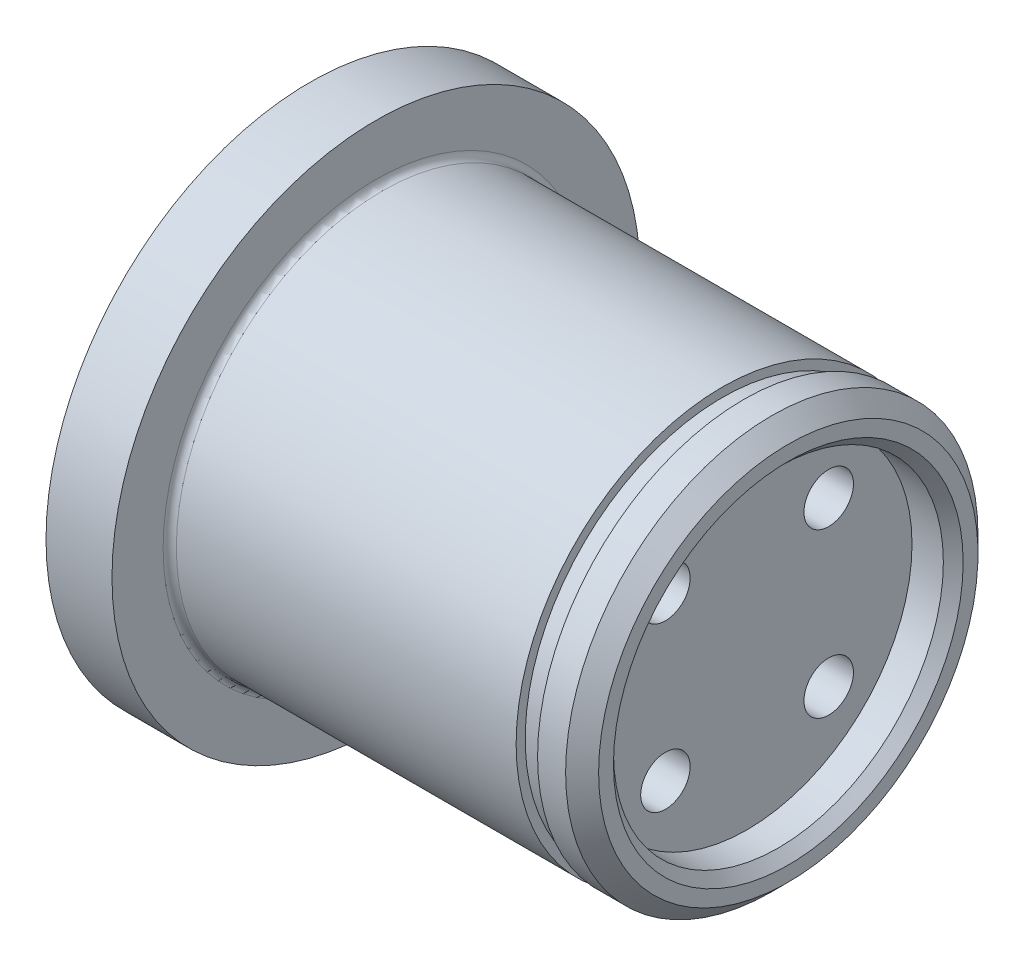
from build123d import *

# Parameters (mm, degrees)
SKETCH_2_W               = 1.3
SKETCH_2_H               = 0.55
CHAMFER_1_SIZE           = 1
FILLET_1_R               = 0.4
HOLE_WIZARD_1_D          = 3
PATTERN_CIRCULAR_1_COUNT = 4
SKETCH_5_W               = 2.5
SKETCH_5_H               = 10
CHAMFER_2_SIZE           = 0.6


with BuildPart() as part:
    # Эскиз1 → Повернуть1 (revolve)
    with BuildSketch(Plane.XY):
        Polygon((0, 0), (0, 12.5), (-25, 12.5), (-25, 16), (-29, 16), (-29, 0), align=None)
    revolve(axis=Axis((0, 0, 0), (1, 0, 0)))

    # Эскиз2 → Вырез-Повернуть1 (revolve, cut)
    with BuildSketch(Plane.XY):
        with Locations((-3.35, 12.225)):
            Rectangle(SKETCH_2_W, SKETCH_2_H)
    revolve(axis=Axis((0, 0, 0), (-1, 0, 0)), mode=Mode.SUBTRACT)

    # Фаска1
    chamfer_1_edges = [part.edges().sort_by_distance(p)[0] for p in [
        (0, -12.5, 0),
    ]]
    chamfer(chamfer_1_edges, length=CHAMFER_1_SIZE)

    # Скругление1
    fillet_1_edges = [part.edges().sort_by_distance(p)[0] for p in [
        (-25, -12.5, 0),
    ]]
    fillet(fillet_1_edges, radius=FILLET_1_R)

    # Отверстие1 (through all)
    with Locations(Plane(origin=(0, 0, 0), x_dir=(0, 0, -1), z_dir=(1, 0, 0))):
        with Locations((4.949747468, 4.949747468)):
            hole_wizard_1 = Hole(HOLE_WIZARD_1_D / 2)

    # Круговой массив1: Отверстие1 ×4 about axis
    pattern_circular_1_axis = Axis((0, 0, 0), (-1, 0, 0))
    for i in range(1, PATTERN_CIRCULAR_1_COUNT):
        add(hole_wizard_1.rotate(pattern_circular_1_axis, i * 360 / PATTERN_CIRCULAR_1_COUNT), mode=Mode.SUBTRACT)

    # Эскиз5 → Вырез-Повернуть2 (revolve, cut)
    with BuildSketch(Plane.XY):
        with Locations((-1.25, 5)):
            Rectangle(SKETCH_5_W, SKETCH_5_H)
    revolve(axis=Axis((0, 0, 0), (-1, 0, 0)), mode=Mode.SUBTRACT)

    # Фаска2
    chamfer_2_edges = [part.edges().sort_by_distance(p)[0] for p in [
        (0, -10, 0),
    ]]
    chamfer(chamfer_2_edges, length=CHAMFER_2_SIZE)


solid = part.part
